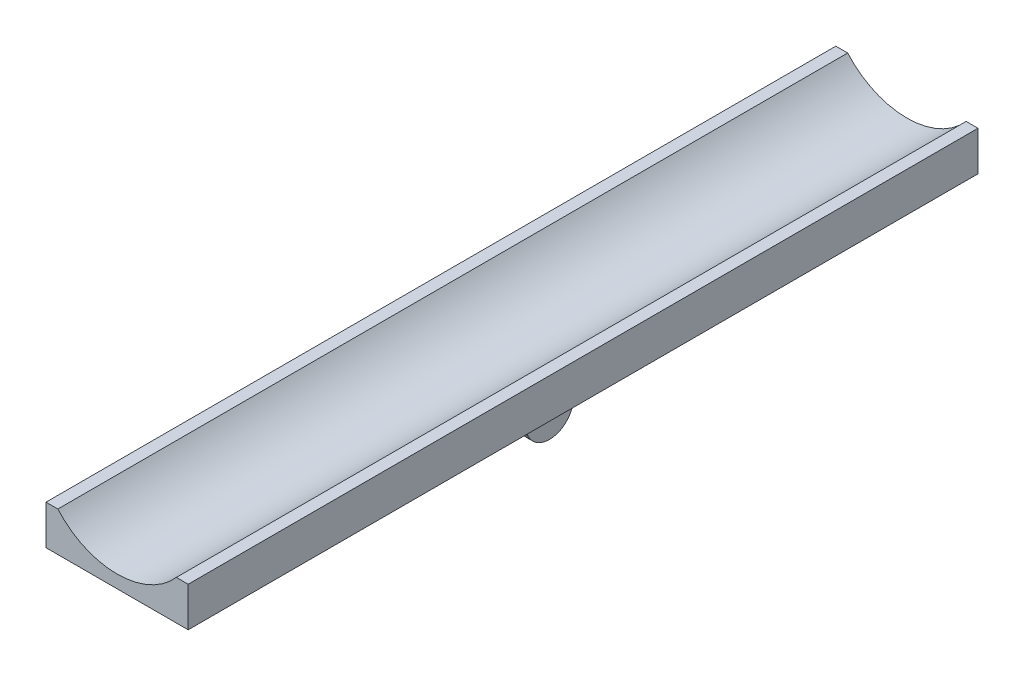
from build123d import *

# Parameters (mm, degrees)
THICKEN1_START           = -92.5
THICKEN1_OUTLINE_W       = 30
THICKEN1_OUTLINE_H       = 4.5
THICKEN1_DEPTH           = 185
THICKEN2_START           = -92.5
THICKEN2_OUTLINE_W       = 3
THICKEN2_OUTLINE_H       = 18
THICKEN2_DEPTH           = 185
THICKEN3_START           = -92.5
THICKEN3_OUTLINE_W       = 3
THICKEN3_OUTLINE_H       = 18
THICKEN3_DEPTH           = 185
BOSS_EXTRUDE1_DEPTH      = 185
SKETCH7_W                = 36
SKETCH7_H                = 8
CUT_EXTRUDE1_DEPTH       = 187.604528348
BOSS_EXTRUDE2_DEPTH      = 7.5
BOSS_EXTRUDE3_START      = 7.5
BOSS_EXTRUDE3_DEPTH      = 7.5
BOSS_EXTRUDE4_DEPTH      = 9.5
BOSS_EXTRUDE4_DEPTH_BACK = 9.5
SKETCH10_R               = 6
SKETCH10_R_2             = 2
BOSS_EXTRUDE5_DEPTH      = 3
BOSS_EXTRUDE5_DEPTH_BACK = 3
SKETCH11_R               = 6
SKETCH11_R_2             = 2
SKETCH12_W               = 19.4
SKETCH12_H               = 6.4
SKETCH12_W_2             = 6.4
CUT_EXTRUDE2_DEPTH       = 2
SKETCH13_W               = 6
SKETCH13_H               = 6
SKETCH13_W_2             = 19
BOSS_EXTRUDE6_DEPTH      = 1.9


# Read off the part's stored shape, not the designer's step: Thicken1, Thicken2, Thicken3
with BuildPart() as part:
    # Thicken1 outline → Thicken1 (new body)
    with BuildSketch(Plane.XY.offset(THICKEN1_START)):
        with Locations((0, 0.75)):
            Rectangle(THICKEN1_OUTLINE_W, THICKEN1_OUTLINE_H)
    extrude(amount=THICKEN1_DEPTH)

    # Thicken2 outline → Thicken2 (add)
    with BuildSketch(Plane.XY.offset(THICKEN2_START)):
        with Locations((16.5, 7.5)):
            Rectangle(THICKEN2_OUTLINE_W, THICKEN2_OUTLINE_H)
    extrude(amount=THICKEN2_DEPTH)

    # Thicken3 outline → Thicken3 (add)
    with BuildSketch(Plane.XY.offset(THICKEN3_START)):
        with Locations((-16.5, 7.5)):
            Rectangle(THICKEN3_OUTLINE_W, THICKEN3_OUTLINE_H)
    extrude(amount=THICKEN3_DEPTH)

    # Sketch4 → Boss-Extrude1 (add)
    with BuildSketch(Plane.XY.offset(92.5)):
        with BuildLine():
            Line((-15, 16.5), (-15, 3))
            Line((-15, 3), (15, 3))
            Line((15, 3), (15, 16.5))
            ThreePointArc((15, 16.5), (0, 9.728756555), (-15, 16.5))
        make_face()
    extrude(amount=-BOSS_EXTRUDE1_DEPTH)

    # Sketch7 → Cut-Extrude1 (cut, through all)
    with BuildSketch(Plane(origin=(0, 0, -92.5), x_dir=(-1, 0, 0), z_dir=(0, 0, -1))):
        with Locations((0, 2.5)):
            Rectangle(SKETCH7_W, SKETCH7_H)
    extrude(amount=-CUT_EXTRUDE1_DEPTH, mode=Mode.SUBTRACT)

    # Sketch8 → Boss-Extrude2 (add)
    with BuildSketch(Plane(origin=(0, 0, -92.5), x_dir=(-1, 0, 0), z_dir=(0, 0, -1))):
        with BuildLine():
            Line((-18, 6.5), (18, 6.5))
            Line((18, 6.5), (18, 16.5))
            Line((18, 16.5), (15, 16.5))
            ThreePointArc((15, 16.5), (0, 9.728756555), (-15, 16.5))
            Line((-15, 16.5), (-18, 16.5))
            Line((-18, 16.5), (-18, 6.5))
        make_face()
    extrude(amount=BOSS_EXTRUDE2_DEPTH)

    # Sketch9 → Boss-Extrude3 (add)
    with BuildSketch(Plane.XY.offset(92.5).offset(BOSS_EXTRUDE3_START)):
        with BuildLine():
            Line((-18, 6.5), (18, 6.5))
            Line((18, 6.5), (18, 16.5))
            Line((18, 16.5), (15, 16.5))
            ThreePointArc((15, 16.5), (0, 9.728756555), (-15, 16.5))
            Line((-15, 16.5), (-18, 16.5))
            Line((-18, 16.5), (-18, 6.5))
        make_face()
    extrude(amount=-BOSS_EXTRUDE3_DEPTH)

    # Sketch10 → Boss-Extrude4 (add, two sides: drawn at the far end of the back side and taken through both)
    # profile 1 of 2: a face of its own
    with BuildSketch(Plane(origin=(0, 0, 0), x_dir=(0, 0, -1), z_dir=(1, 0, 0)).offset(-BOSS_EXTRUDE4_DEPTH_BACK)):
        Circle(SKETCH10_R)
        with Locations(Location((0, 0, 0), (0, 0, 90))):
            Circle(SKETCH10_R_2, mode=Mode.SUBTRACT)
    # profile 2 of 2: a face of its own
    with BuildSketch(Plane(origin=(0, 0, 0), x_dir=(0, 0, -1), z_dir=(1, 0, 0)).offset(-BOSS_EXTRUDE4_DEPTH_BACK)):
        with BuildLine():
            Line((10, 6.5), (-10, 6.5))
            Line((-10, 6.5), (-5.35678593, -2.702747584))
            ThreePointArc((-5.35678593, -2.702747584), (-1.389115622, 5.836981908), (6, 0))
            ThreePointArc((6, 0), (5.836981908, -1.389115622), (5.35678593, -2.702747584))
            Line((5.35678593, -2.702747584), (10, 6.5))
        make_face()
    extrude(amount=BOSS_EXTRUDE4_DEPTH + BOSS_EXTRUDE4_DEPTH_BACK)

    # Sketch11 → Boss-Extrude5 (add, two sides: drawn at the far end of the back side and taken through both)
    # profile 1 of 2: a face of its own
    with BuildSketch(Plane(origin=(0, 0, 0), x_dir=(0, 0, -1), z_dir=(1, 0, 0)).offset(-BOSS_EXTRUDE5_DEPTH_BACK)):
        with Locations((92.5, 0)):
            Circle(SKETCH11_R)
        with Locations(Location((92.5, 0, 0), (0, 0, 90))):
            Circle(SKETCH11_R_2, mode=Mode.SUBTRACT)
    # profile 2 of 2: a face of its own
    with BuildSketch(Plane(origin=(0, 0, 0), x_dir=(0, 0, -1), z_dir=(1, 0, 0)).offset(-BOSS_EXTRUDE5_DEPTH_BACK)):
        with BuildLine():
            ThreePointArc((86.5, 0), (92.5, 6), (98.5, 0))
            Line((98.5, 0), (98.5, 6.5))
            Line((98.5, 6.5), (86.5, 6.5))
            Line((86.5, 6.5), (86.5, 0))
        make_face()
    extrude(amount=BOSS_EXTRUDE5_DEPTH + BOSS_EXTRUDE5_DEPTH_BACK)


with BuildPart() as body_2:
    # Split1: the piece on the far side of the plane
    add(part.part)
    split(bisect_by=Plane(origin=(0, 6.5, 0), x_dir=(0, 0, -1), z_dir=(0, -1, 0)), keep=Keep.BOTTOM)

    # Sketch12 → Cut-Extrude2 (cut)
    with BuildSketch(Plane.XZ.offset(-6.5)):
        Rectangle(SKETCH12_W, SKETCH12_H)
        with Locations((0, -92.5)):
            Rectangle(SKETCH12_W_2, SKETCH12_H)
    extrude(amount=-CUT_EXTRUDE2_DEPTH, mode=Mode.SUBTRACT)


with BuildPart() as part_1:
    add(part.part)

    # Split1
    split(bisect_by=Plane(origin=(0, 6.5, 0), x_dir=(0, 0, -1), z_dir=(0, -1, 0)), keep=Keep.TOP)

    # Sketch13 → Boss-Extrude6 (add)
    with BuildSketch(Plane(origin=(0, 6.5, 0), x_dir=(1, 0, 0), z_dir=(0, 1, 0))):
        with Locations((0, 92.5)):
            Rectangle(SKETCH13_W, SKETCH13_H)
        Rectangle(SKETCH13_W_2, SKETCH13_H)
    extrude(amount=BOSS_EXTRUDE6_DEPTH)


solid = Compound([body_2.part, part_1.part])
